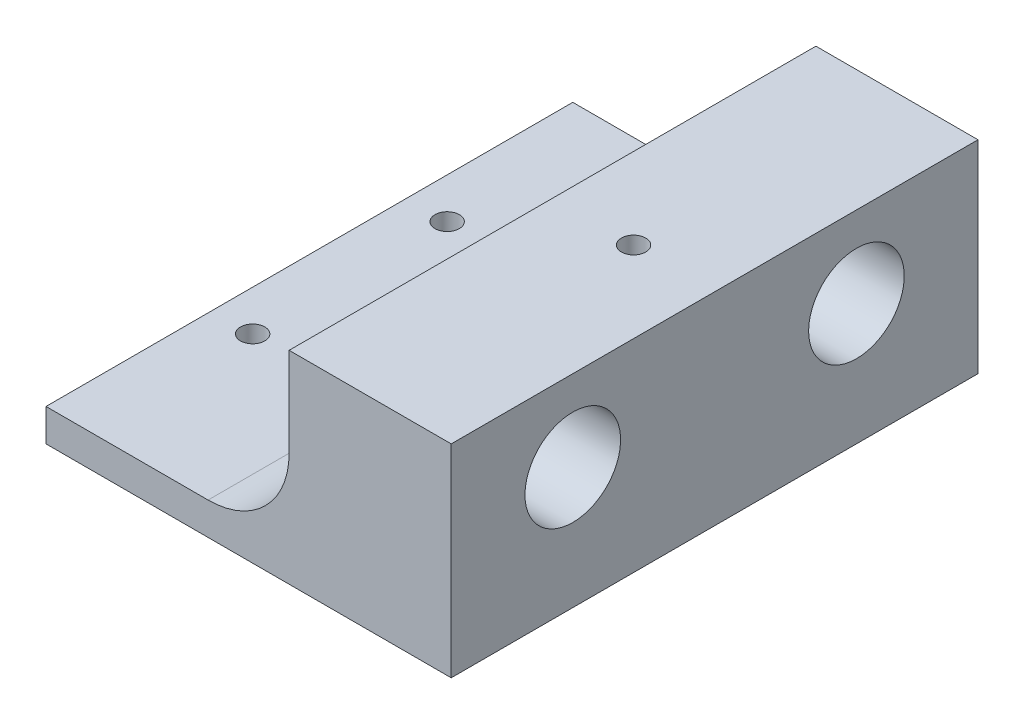
from build123d import *

# Parameters (mm, degrees)
BOSS_EXTRUDE1_DEPTH     = 32.5
CUT_EXTRUDE1_DEPTH      = 65.662585782
CUT_EXTRUDE1_DEPTH_BACK = 65.662585782
SKETCH2_R               = 5.9
CUT_EXTRUDE2_DEPTH      = 58.282196244
CUT_EXTRUDE2_DEPTH_BACK = 58.282196244
SKETCH3_R               = 1.5
CUT_EXTRUDE3_DEPTH      = 58.282196244
CUT_EXTRUDE3_DEPTH_BACK = 58.282196244
SKETCH4_R               = 1.5


with BuildPart() as part:
    # Sketch1 → Boss-Extrude1 (new, symmetric)
    with BuildSketch(Plane.XY):
        with BuildLine():
            Line((-40, 0), (-40, 4))
            Line((-40, 4), (-20, 4))
            ThreePointArc((-20, 4), (-12.928932188, 6.928932188), (-10, 14))
            Line((-10, 14), (-10, 25))
            Line((-10, 25), (10, 25))
            Line((10, 25), (10, 14))
            Line((10, 14), (10, 0))
            Line((10, 0), (-40, 0))
        make_face()
    extrude(amount=BOSS_EXTRUDE1_DEPTH, both=True)

    # Sketch2 → Cut-Extrude1 (cut, two sides: drawn at the far end of the back side and taken through both)
    with BuildSketch(Plane(origin=(10, 0, 0), x_dir=(0, 0, -1), z_dir=(1, 0, 0)).offset(-CUT_EXTRUDE1_DEPTH_BACK)):
        with Locations((-17.5, 15)):
            Circle(SKETCH2_R)
        with Locations((17.5, 15)):
            Circle(SKETCH2_R)
    extrude(amount=CUT_EXTRUDE1_DEPTH + CUT_EXTRUDE1_DEPTH_BACK, mode=Mode.SUBTRACT)

    # Sketch3 → Cut-Extrude2 (cut, two sides: drawn at the far end of the back side and taken through both)
    with BuildSketch(Plane.XZ.offset(-CUT_EXTRUDE2_DEPTH_BACK)):
        with Locations((-35, 12)):
            Circle(SKETCH3_R)
        with Locations((-35, -12)):
            Circle(SKETCH3_R)
    extrude(amount=CUT_EXTRUDE2_DEPTH + CUT_EXTRUDE2_DEPTH_BACK, mode=Mode.SUBTRACT)

    # Sketch4 → Cut-Extrude3 (cut, two sides: drawn at the far end of the back side and taken through both)
    with BuildSketch(Plane(origin=(0, 25, 0), x_dir=(1, 0, 0), z_dir=(0, 1, 0)).offset(-CUT_EXTRUDE3_DEPTH_BACK)):
        Circle(SKETCH4_R)
    extrude(amount=CUT_EXTRUDE3_DEPTH + CUT_EXTRUDE3_DEPTH_BACK, mode=Mode.SUBTRACT)


solid = part.part
